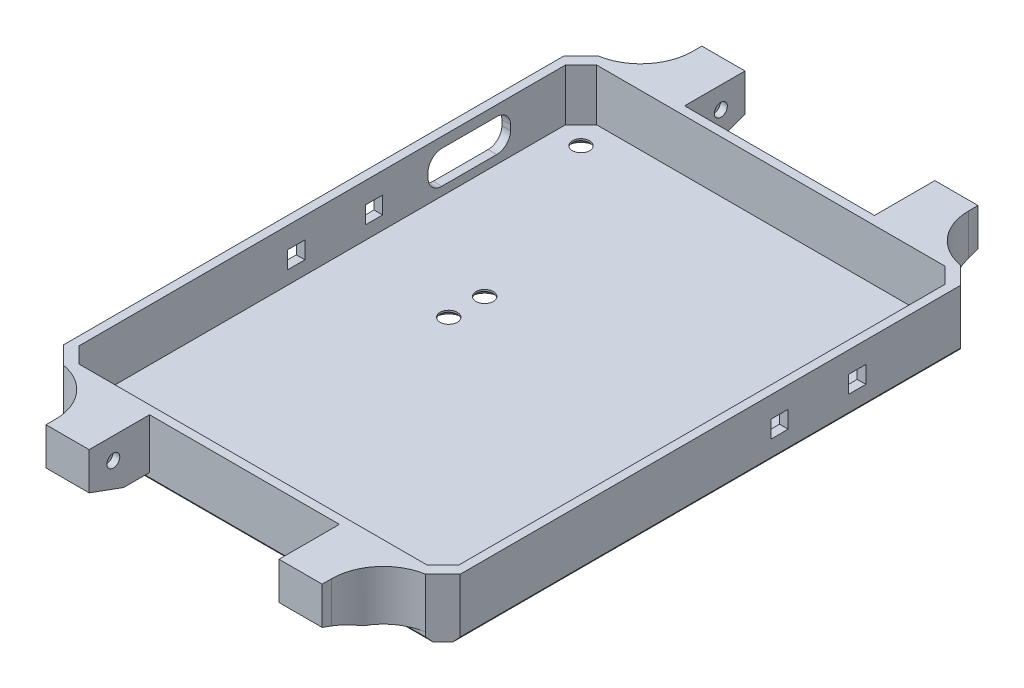
from build123d import *
from OCP.BRepFilletAPI import BRepFilletAPI_MakeChamfer

# Parameters (mm, degrees)
SKETCH1_W                   = 46
SKETCH1_H                   = 62
SKETCH1_W_2                 = 44
SKETCH1_H_2                 = 60
BOSS_EXTRUDE1_DEPTH         = 6
SKETCH2_W                   = 46
SKETCH2_H                   = 62
BOSS_EXTRUDE2_DEPTH         = 0.8
SKETCH3_W                   = 44
SKETCH3_H                   = 60
SKETCH3_R                   = 1
BOSS_EXTRUDE3_DEPTH         = 6
SKETCH7_W                   = 44
SKETCH7_H                   = 60
CUT_EXTRUDE3_DEPTH          = 19.6
SKETCH3_5_R                 = 1
CUT_EXTRUDE7_DEPTH          = 10
SKETCH14_R                  = 1
CUT_EXTRUDE12_DEPTH         = 4.5
CHAMFER5_SIZE               = 0.6
CHAMFER7_SIZE               = 0.5
CHAMFER7_SIZE2              = 0.419549816
CHAMFER9_SIZE               = 1.8
CHAMFER10_SIZE              = 2
SKETCH15_W                  = 9.55
SKETCH15_H                  = 3.8
CUT_EXTRUDE13_DEPTH         = 10
FILLET6_R                   = 1.6
SKETCH17_W                  = 2
SKETCH17_H                  = 2
CUT_EXTRUDE14_DEPTH         = 10
SKETCH19_W                  = 5
SKETCH19_H                  = 5.8
BOSS_EXTRUDE6_DEPTH         = 7
CHAMFER11_SIZE              = 4
CHAMFER11_SIZE2             = 1.455880937
CUT_EXTRUDE15_START         = -0.8
SKETCH20_R                  = 0.75
CUT_EXTRUDE15_DEPTH         = 23.6
CHAMFER11_OF_MIRROR17_SIZE  = 4
CHAMFER11_OF_MIRROR17_SIZE2 = 1.455880937
FILLET7_R                   = 6
SKETCH21_W                  = 2
SKETCH21_H                  = 2
CUT_EXTRUDE16_DEPTH         = 10


with BuildPart() as part:
    # Sketch1 → Boss-Extrude1 (new body)
    with BuildSketch(Plane(origin=(0, 0, 0), x_dir=(1, 0, 0), z_dir=(0, 1, 0))):
        Rectangle(SKETCH1_W, SKETCH1_H)
        Rectangle(SKETCH1_W_2, SKETCH1_H_2, mode=Mode.SUBTRACT)
    extrude(amount=BOSS_EXTRUDE1_DEPTH)

    # Sketch2 → Boss-Extrude2 (add)
    with BuildSketch(Plane.XZ):
        Rectangle(SKETCH2_W, SKETCH2_H)
    extrude(amount=BOSS_EXTRUDE2_DEPTH)

    # Sketch3 → Boss-Extrude3 (add)
    # profile 1 of 4: a face of its own
    with BuildSketch(Plane(origin=(0, 0, 0), x_dir=(1, 0, 0), z_dir=(0, 1, 0))):
        Rectangle(SKETCH3_W, SKETCH3_H)
        with Locations(Location((-19, -27, 0), (0, 0, 90))):
            Circle(SKETCH3_R, mode=Mode.SUBTRACT)
        with Locations(Location((19, -27, 0), (0, 0, 270))):
            Circle(SKETCH3_R, mode=Mode.SUBTRACT)
        with Locations(Location((-19, 27, 0), (0, 0, 270))):
            Circle(SKETCH3_R, mode=Mode.SUBTRACT)
        with Locations(Location((19, 27, 0), (0, 0, 90))):
            Circle(SKETCH3_R, mode=Mode.SUBTRACT)
    # profile 2 of 4: a face of its own
    with BuildSketch(Plane(origin=(0, 0, 0), x_dir=(1, 0, 0), z_dir=(0, 1, 0))):
        Rectangle(SKETCH3_W, SKETCH3_H)
        with Locations(Location((-19, -27, 0), (0, 0, 90))):
            Circle(SKETCH3_R, mode=Mode.SUBTRACT)
        with Locations(Location((19, -27, 0), (0, 0, 270))):
            Circle(SKETCH3_R, mode=Mode.SUBTRACT)
        with Locations(Location((-19, 27, 0), (0, 0, 270))):
            Circle(SKETCH3_R, mode=Mode.SUBTRACT)
        with Locations(Location((19, 27, 0), (0, 0, 90))):
            Circle(SKETCH3_R, mode=Mode.SUBTRACT)
    # profile 3 of 4: a face of its own
    with BuildSketch(Plane(origin=(0, 0, 0), x_dir=(1, 0, 0), z_dir=(0, 1, 0))):
        Rectangle(SKETCH3_W, SKETCH3_H)
        with Locations(Location((-19, -27, 0), (0, 0, 90))):
            Circle(SKETCH3_R, mode=Mode.SUBTRACT)
        with Locations(Location((19, -27, 0), (0, 0, 270))):
            Circle(SKETCH3_R, mode=Mode.SUBTRACT)
        with Locations(Location((-19, 27, 0), (0, 0, 270))):
            Circle(SKETCH3_R, mode=Mode.SUBTRACT)
        with Locations(Location((19, 27, 0), (0, 0, 90))):
            Circle(SKETCH3_R, mode=Mode.SUBTRACT)
    # profile 4 of 4: a face of its own
    with BuildSketch(Plane(origin=(0, 0, 0), x_dir=(1, 0, 0), z_dir=(0, 1, 0))):
        Rectangle(SKETCH3_W, SKETCH3_H)
        with Locations(Location((-19, -27, 0), (0, 0, 90))):
            Circle(SKETCH3_R, mode=Mode.SUBTRACT)
        with Locations(Location((19, -27, 0), (0, 0, 270))):
            Circle(SKETCH3_R, mode=Mode.SUBTRACT)
        with Locations(Location((-19, 27, 0), (0, 0, 270))):
            Circle(SKETCH3_R, mode=Mode.SUBTRACT)
        with Locations(Location((19, 27, 0), (0, 0, 90))):
            Circle(SKETCH3_R, mode=Mode.SUBTRACT)
    extrude(amount=BOSS_EXTRUDE3_DEPTH)

    # Sketch7 → Cut-Extrude3 (cut)
    with BuildSketch(Plane(origin=(0, 0, 0), x_dir=(1, 0, 0), z_dir=(0, 1, 0))):
        Rectangle(SKETCH7_W, SKETCH7_H)
    extrude(amount=CUT_EXTRUDE3_DEPTH, mode=Mode.SUBTRACT)

    # Sketch3<5> → Cut-Extrude7 (cut)
    with BuildSketch(Plane(origin=(0, 0, 0), x_dir=(1, 0, 0), z_dir=(0, 1, 0))):
        with Locations(Location((-19, 27, 0), (0, 0, 270))):
            Circle(SKETCH3_5_R)
        with Locations(Location((19, 27, 0), (0, 0, 270))):
            Circle(SKETCH3_5_R)
        with Locations(Location((19, -27, 0), (0, 0, 270))):
            Circle(SKETCH3_5_R)
        with Locations(Location((-19, -27, 0), (0, 0, 270))):
            Circle(SKETCH3_5_R)
    extrude(amount=-CUT_EXTRUDE7_DEPTH, mode=Mode.SUBTRACT)

    # Sketch14 → Cut-Extrude12 (cut)
    with BuildSketch(Plane(origin=(0, 0, 0), x_dir=(1, 0, 0), z_dir=(0, 1, 0))):
        with Locations(Location((-9.45, 6.284530189, 0), (0, 0, 270))):
            Circle(SKETCH14_R)
        with Locations(Location((-9.45, 2.115469811, 0), (0, 0, 270))):
            Circle(SKETCH14_R)
    extrude(amount=-CUT_EXTRUDE12_DEPTH, mode=Mode.SUBTRACT)

    # Chamfer5
    chamfer5_edges = [part.edges().sort_by_distance(p)[0] for p in [
        (-19, -0.8, -28),
        (-9.45, -0.8, -7.284530189),
        (-9.45, -0.8, -3.115469811),
        (-19, -0.8, 26),
        (19, -0.8, 26),
        (19, -0.8, -28),
    ]]
    chamfer(chamfer5_edges, length=CHAMFER5_SIZE)

    # Chamfer7: one chamfer whose edges measure the first distance from different faces: ONE call of the kernel's chamfer builder (chamfer() names one face for all edges)
    chamfer7_edges_1 = [part.edges().sort_by_distance(p)[0] for p in [
        (-23, -0.8, 0),
    ]]
    chamfer7_side_1 = [part.faces().sort_by_distance(p)[0] for p in [
        (-23, 2.6, 0),
    ]]
    chamfer7_edges_2 = [part.edges().sort_by_distance(p)[0] for p in [
        (0, -0.8, -31),
    ]]
    chamfer7_side_2 = [part.faces().sort_by_distance(p)[0] for p in [
        (0, 2.6, -31),
    ]]
    chamfer7_edges_3 = [part.edges().sort_by_distance(p)[0] for p in [
        (23, -0.8, 0),
    ]]
    chamfer7_side_3 = [part.faces().sort_by_distance(p)[0] for p in [
        (23, 2.6, 0),
    ]]
    chamfer7_edges_4 = [part.edges().sort_by_distance(p)[0] for p in [
        (0, -0.8, 31),
    ]]
    chamfer7_side_4 = [part.faces().sort_by_distance(p)[0] for p in [
        (0, 2.6, 31),
    ]]
    chamfer7 = BRepFilletAPI_MakeChamfer(part.part.solid().wrapped)
    for e in chamfer7_edges_1:
        chamfer7.Add(CHAMFER7_SIZE, CHAMFER7_SIZE2, e.wrapped, chamfer7_side_1[0].wrapped)  # the first distance lies on this face
    for e in chamfer7_edges_2:
        chamfer7.Add(CHAMFER7_SIZE, CHAMFER7_SIZE2, e.wrapped, chamfer7_side_2[0].wrapped)  # the first distance lies on this face
    for e in chamfer7_edges_3:
        chamfer7.Add(CHAMFER7_SIZE, CHAMFER7_SIZE2, e.wrapped, chamfer7_side_3[0].wrapped)  # the first distance lies on this face
    for e in chamfer7_edges_4:
        chamfer7.Add(CHAMFER7_SIZE, CHAMFER7_SIZE2, e.wrapped, chamfer7_side_4[0].wrapped)  # the first distance lies on this face
    add(Compound.cast(chamfer7.Shape()), mode=Mode.REPLACE)

    # Chamfer9
    chamfer9_edges = [part.edges().sort_by_distance(p)[0] for p in [
        (-22, 3, -30),
        (-22, 3, 30),
        (22, 3, 30),
        (22, 3, -30),
    ]]
    chamfer(chamfer9_edges, length=CHAMFER9_SIZE)

    # Chamfer10
    # the kernel refuses this chamfer: 2 mm, written as the material it takes off along each edge
    with BuildSketch(Plane(origin=(23, -5.443365976, 31), x_dir=(-0.9996219169112968, 1.5667810843409742e-15, 0.027495876610585647), z_dir=(0, 1, 0)), Plane(origin=(-23, 11.143365976, 31), x_dir=(0.9996219169112968, 0, 0.027495876610585647), z_dir=(0, -1, 0)), Plane(origin=(-23, 11.143365976, -31), x_dir=(-0.027495876610585647, 0, 0.9996219169112968), z_dir=(0, -1, 0)), Plane(origin=(23, -5.443365976, -31), x_dir=(0.027495876610585647, 0, 0.9996219169112968), z_dir=(0, 1, 0))) as chamfer10_piece_1:
        Polygon((CHAMFER10_SIZE * 0.999621916911, -CHAMFER10_SIZE * 0.0274958766106), (-CHAMFER10_SIZE * 0.0274958766106, -CHAMFER10_SIZE * 0.999621916911), (0, 0), align=None)
    extrude(amount=16.586731952, mode=Mode.SUBTRACT)

    # Sketch15 → Cut-Extrude13 (cut)
    with BuildSketch(Plane(origin=(-23, 0, -8), x_dir=(0, 0, -1), z_dir=(1, 0, 0))):
        with Locations((9.048605705, 2.9)):
            Rectangle(SKETCH15_W, SKETCH15_H)
    extrude(amount=CUT_EXTRUDE13_DEPTH, mode=Mode.SUBTRACT)

    # Fillet6
    fillet6_edges = [part.edges().sort_by_distance(p)[0] for p in [
        (-22.5, 4.8, -12.273605705),
        (-22.5, 1, -12.273605705),
        (-22.5, 1, -21.823605705),
        (-22.5, 4.8, -21.823605705),
    ]]
    fillet(fillet6_edges, radius=FILLET6_R)

    # Sketch17 → Cut-Extrude14 (cut)
    with BuildSketch(Plane.ZY.offset(23)):
        with Locations((-6.001655918, 2.54848205)):
            Rectangle(SKETCH17_W, SKETCH17_H)
        with Locations((2.998344082, 2.54848205)):
            Rectangle(SKETCH17_W, SKETCH17_H)
    extrude(amount=-CUT_EXTRUDE14_DEPTH, mode=Mode.SUBTRACT)

    # Sketch19 → Boss-Extrude6 (add)
    with BuildSketch(Plane.XY.offset(31)):
        with Locations((-13.5, 3.1)):
            Rectangle(SKETCH19_W, SKETCH19_H)
        with Locations((13.5, 3.1)):
            Rectangle(SKETCH19_W, SKETCH19_H)
    boss_extrude6 = extrude(amount=BOSS_EXTRUDE6_DEPTH)

    # Chamfer11: one chamfer whose edges measure the first distance from different faces: ONE call of the kernel's chamfer builder (chamfer() names one face for all edges)
    chamfer11_edges_1 = [part.edges().sort_by_distance(p)[0] for p in [
        (-13.5, 0.2, 38),
    ]]
    chamfer11_side_1 = [part.faces().sort_by_distance(p)[0] for p in [
        (-13.5, 0.2, 34.5),
    ]]
    chamfer11_edges_2 = [part.edges().sort_by_distance(p)[0] for p in [
        (13.5, 0.2, 38),
    ]]
    chamfer11_side_2 = [part.faces().sort_by_distance(p)[0] for p in [
        (13.5, 0.2, 34.5),
    ]]
    chamfer11 = BRepFilletAPI_MakeChamfer(part.part.solid().wrapped)
    for e in chamfer11_edges_1:
        chamfer11.Add(CHAMFER11_SIZE, CHAMFER11_SIZE2, e.wrapped, chamfer11_side_1[0].wrapped)  # the first distance lies on this face
    for e in chamfer11_edges_2:
        chamfer11.Add(CHAMFER11_SIZE, CHAMFER11_SIZE2, e.wrapped, chamfer11_side_2[0].wrapped)  # the first distance lies on this face
    add(Compound.cast(chamfer11.Shape()), mode=Mode.REPLACE)

    # Sketch20 → Cut-Extrude15 (cut)
    with BuildSketch(Plane(origin=(-11, 0, 0), x_dir=(0, 0, -1), z_dir=(1, 0, 0)).offset(CUT_EXTRUDE15_START)):
        with Locations(Location((-35.2, 3.5, 0), (0, 0, 90))):
            Circle(SKETCH20_R)
    cut_extrude15 = extrude(amount=CUT_EXTRUDE15_DEPTH, mode=Mode.SUBTRACT)

    # Mirror17: Boss-Extrude6, Cut-Extrude15 across plane
    add(boss_extrude6.mirror(Plane.XY))
    add(cut_extrude15.mirror(Plane.XY), mode=Mode.SUBTRACT)

    # Chamfer11 of Mirror17: one chamfer whose edges measure the first distance from different faces: ONE call of the kernel's chamfer builder (chamfer() names one face for all edges)
    chamfer11_of_mirror17_edges_1 = [part.edges().sort_by_distance(p)[0] for p in [
        (-13.5, 0.2, -38),
    ]]
    chamfer11_of_mirror17_side_1 = [part.faces().sort_by_distance(p)[0] for p in [
        (-13.5, 0.2, -34.5),
    ]]
    chamfer11_of_mirror17_edges_2 = [part.edges().sort_by_distance(p)[0] for p in [
        (13.5, 0.2, -38),
    ]]
    chamfer11_of_mirror17_side_2 = [part.faces().sort_by_distance(p)[0] for p in [
        (13.5, 0.2, -34.5),
    ]]
    chamfer11_of_mirror17 = BRepFilletAPI_MakeChamfer(part.part.solid().wrapped)
    for e in chamfer11_of_mirror17_edges_1:
        chamfer11_of_mirror17.Add(CHAMFER11_OF_MIRROR17_SIZE, CHAMFER11_OF_MIRROR17_SIZE2, e.wrapped, chamfer11_of_mirror17_side_1[0].wrapped)  # the first distance lies on this face
    for e in chamfer11_of_mirror17_edges_2:
        chamfer11_of_mirror17.Add(CHAMFER11_OF_MIRROR17_SIZE, CHAMFER11_OF_MIRROR17_SIZE2, e.wrapped, chamfer11_of_mirror17_side_2[0].wrapped)  # the first distance lies on this face
    add(Compound.cast(chamfer11_of_mirror17.Shape()), mode=Mode.REPLACE)

    # Fillet7
    # the kernel refuses this fillet: 6 mm, written as the material it adds along each edge
    with BuildSketch(Plane(origin=(16, 0.2, 31), x_dir=(1, 0, 0), z_dir=(0, 1, 0))) as fillet7_piece_1_section:
        with BuildLine():
            CenterArc((6, -5.916079783), FILLET7_R, 99.594068227, 80.405931773)
            Line((0, -5.916079783), (-0.12, -5.916079783))
            Line((-0.12, -5.916079783), (-0.12, 0))
            Line((-0.12, 0), (0, 0.12))
            ThreePointArc((0, 0.12), (2.5, 0.12), (4.98, 0.118321596))
            Line((4.98, 0.118321596), (5, 0))
        make_face()
    fillet7_piece_1 = extrude(amount=5.8, mode=Mode.PRIVATE)
    fillet7_piece_1 = split(fillet7_piece_1, bisect_by=Plane(origin=(16.527662271, 0.235819169, 34.098412357), z_dir=(0, 0.9396926207859081, -0.34202014332566943)), keep=Keep.TOP, mode=Mode.PRIVATE)
    add(fillet7_piece_1)
    with BuildSketch(Plane(origin=(-16, 0.2, 31), x_dir=(-1, 0, 0), z_dir=(0, 1, 0))) as fillet7_piece_2_section:
        with BuildLine():
            CenterArc((6, 5.916079783), FILLET7_R, 180, 80.405931773)
            Line((0, 5.916079783), (-0.12, 5.916079783))
            Line((-0.12, 5.916079783), (-0.12, 0))
            Line((-0.12, 0), (0, -0.12))
            ThreePointArc((0, -0.12), (2.5, -0.12), (4.98, -0.118321596))
            Line((4.98, -0.118321596), (5, 0))
        make_face()
    fillet7_piece_2 = extrude(amount=5.8, mode=Mode.PRIVATE)
    fillet7_piece_2 = split(fillet7_piece_2, bisect_by=Plane(origin=(-16.527662271, 0.235819169, 34.098412357), z_dir=(0, 0.9396926207859081, -0.34202014332566943)), keep=Keep.TOP, mode=Mode.PRIVATE)
    add(fillet7_piece_2)
    with BuildSketch(Plane(origin=(-16, 0.2, -31), x_dir=(0, 0, -1), z_dir=(0, 1, 0))) as fillet7_piece_3_section:
        with BuildLine():
            CenterArc((5.916079783, 6), FILLET7_R, 189.594068227, 80.405931773)
            Line((0, 5), (-0.118321596, 4.98))
            ThreePointArc((-0.118321596, 4.98), (-0.12, 2.5), (-0.12, 0))
            Line((-0.12, 0), (0, -0.12))
            Line((0, -0.12), (5.916079783, -0.12))
            Line((5.916079783, -0.12), (5.916079783, 0))
        make_face()
    fillet7_piece_3 = extrude(amount=5.8, mode=Mode.PRIVATE)
    fillet7_piece_3 = split(fillet7_piece_3, bisect_by=Plane(origin=(-15.957282579, 1.368762804, -37.211149414), z_dir=(0, 0.9396926207859081, 0.34202014332566943)), keep=Keep.TOP, mode=Mode.PRIVATE)
    add(fillet7_piece_3)
    with BuildSketch(Plane(origin=(16, 0.2, -31), x_dir=(1, 0, 0), z_dir=(0, 1, 0))) as fillet7_piece_4_section:
        with BuildLine():
            CenterArc((6, 5.916079783), FILLET7_R, 180, 80.405931773)
            Line((0, 5.916079783), (-0.12, 5.916079783))
            Line((-0.12, 5.916079783), (-0.12, 0))
            Line((-0.12, 0), (0, -0.12))
            ThreePointArc((0, -0.12), (2.5, -0.12), (4.98, -0.118321596))
            Line((4.98, -0.118321596), (5, 0))
        make_face()
    fillet7_piece_4 = extrude(amount=5.8, mode=Mode.PRIVATE)
    fillet7_piece_4 = split(fillet7_piece_4, bisect_by=Plane(origin=(16.527662271, 0.235819169, -34.098412357), z_dir=(0, 0.9396926207859081, 0.34202014332566943)), keep=Keep.TOP, mode=Mode.PRIVATE)
    add(fillet7_piece_4)

    # Sketch21 → Cut-Extrude16 (cut)
    with BuildSketch(Plane(origin=(23, 0, 0), x_dir=(0, 0, -1), z_dir=(1, 0, 0))):
        with Locations((17, 2.55)):
            Rectangle(SKETCH21_W, SKETCH21_H)
        with Locations((8, 2.55)):
            Rectangle(SKETCH21_W, SKETCH21_H)
    extrude(amount=-CUT_EXTRUDE16_DEPTH, mode=Mode.SUBTRACT)


solid = part.part
